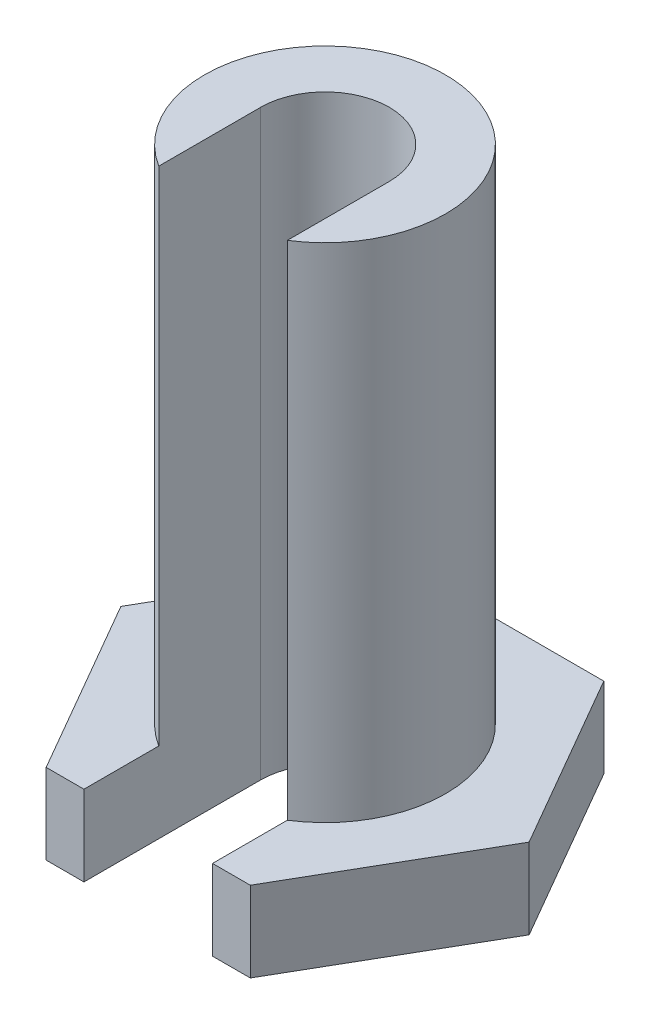
from build123d import *

# Parameters (mm, degrees)
SKETCH1_R               = 3
BOSS_EXTRUDE1_DEPTH     = 14.5
BOSS_EXTRUDE2_DEPTH     = 2
CUT_EXTRUDE1_DEPTH      = 16.981969007
CUT_EXTRUDE1_DEPTH_BACK = 16.981969007


with BuildPart() as part:
    # Sketch1 → Boss-Extrude1 (new body)
    with BuildSketch(Plane(origin=(0, 0, 0), x_dir=(1, 0, 0), z_dir=(0, 1, 0))):
        Circle(SKETCH1_R)
    extrude(amount=BOSS_EXTRUDE1_DEPTH)

    # Sketch3 → Boss-Extrude2 (add)
    with BuildSketch(Plane(origin=(0, 0, 0), x_dir=(-1, 0, 0), z_dir=(0, -1, 0))):
        Polygon((5.080682369, 0), (2.540341184, 4.4), (-2.540341184, 4.4), (-5.080682369, 0), (-2.540341184, -4.4), (2.540341184, -4.4), align=None)
    extrude(amount=-BOSS_EXTRUDE2_DEPTH)

    # Sketch4 → Cut-Extrude1 (cut, two sides: drawn at the far end of the back side and taken through both)
    with BuildSketch(Plane(origin=(0, 14.5, 0), x_dir=(1, 0, 0), z_dir=(0, 1, 0)).offset(-CUT_EXTRUDE1_DEPTH_BACK)):
        with BuildLine():
            Line((-1.6, 0), (-1.6, -4.4))
            Line((-1.6, -4.4), (1.6, -4.4))
            Line((1.6, -4.4), (1.6, 0))
            ThreePointArc((1.6, 0), (0, 1.6), (-1.6, 0))
        make_face()
    extrude(amount=CUT_EXTRUDE1_DEPTH + CUT_EXTRUDE1_DEPTH_BACK, mode=Mode.SUBTRACT)


solid = part.part
